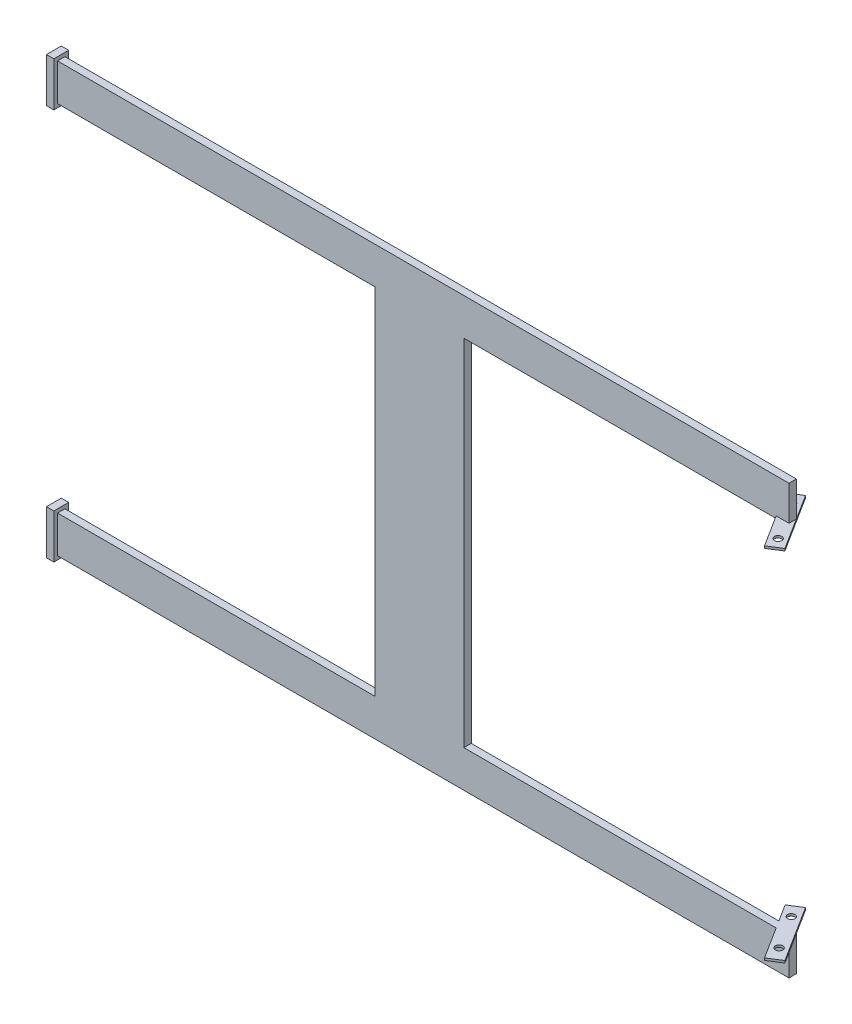
from build123d import *

# Parameters (mm, degrees)
SKETCH1_W           = 1000
SKETCH1_H           = 580
BOSS_EXTRUDE1_DEPTH = 10
SKETCH2_W           = 440
SKETCH2_H           = 480
CUT_EXTRUDE3_DEPTH  = 795.596872652
SHELL2_START        = -593.858216583
SHELL2_OUTLINE_W    = 48
SHELL2_OUTLINE_H    = 8
SHELL2_DEPTH        = 998
SHELL2_START_2      = -153.858216583
SHELL2_2_OUTLINE_W  = 482
SHELL2_2_OUTLINE_H  = 8
SHELL2_2_DEPTH      = 118
BOSS_EXTRUDE2_DEPTH = 3
BOSS_EXTRUDE4_DEPTH = 3
SKETCH11_R          = 5
CUT_EXTRUDE6_DEPTH  = 799.473143596
SKETCH13_R          = 5
CUT_EXTRUDE7_DEPTH  = 799.473143596
SKETCH14_W          = 20
SKETCH14_H          = 60
BOSS_EXTRUDE5_DEPTH = 10
SKETCH15_W          = 20
SKETCH15_H          = 60
BOSS_EXTRUDE6_DEPTH = 10


# Read off the part's stored shape, not the designer's step: Shell2
with BuildPart() as part:
    # Sketch1 → Boss-Extrude1 (new body)
    with BuildSketch(Plane.XY):
        with Locations((-94.858216583, -236.714241493)):
            Rectangle(SKETCH1_W, SKETCH1_H)
    extrude(amount=BOSS_EXTRUDE1_DEPTH)

    # Sketch2 → Cut-Extrude3 (cut, through all)
    with BuildSketch(Plane.XY.offset(10)):
        with Locations((185.141783417, -236.714241493)):
            Rectangle(SKETCH2_W, SKETCH2_H)
        with Locations((-374.858216583, -236.714241493)):
            Rectangle(SKETCH2_W, SKETCH2_H)
    extrude(amount=-CUT_EXTRUDE3_DEPTH, mode=Mode.SUBTRACT)

    # Shell2 outline → Shell2 (cut)
    with BuildSketch(Plane.YZ.offset(SHELL2_START)):
        with Locations((-501.714241493, 5)):
            Rectangle(SHELL2_OUTLINE_W, SHELL2_OUTLINE_H)
        with Locations((28.285758507, 5)):
            Rectangle(SHELL2_OUTLINE_W, SHELL2_OUTLINE_H)
    extrude(amount=SHELL2_DEPTH, mode=Mode.SUBTRACT)

    # Shell2 2 outline → Shell2 2 (cut)
    with BuildSketch(Plane.YZ.offset(SHELL2_START_2)):
        with Locations((-236.714241493, 5)):
            Rectangle(SHELL2_2_OUTLINE_W, SHELL2_2_OUTLINE_H)
    extrude(amount=SHELL2_2_DEPTH, mode=Mode.SUBTRACT)

    # Sketch5 → Boss-Extrude2 (add)
    with BuildSketch(Plane(origin=(0, -476.714241493, 0), x_dir=(1, 0, 0), z_dir=(0, 1, 0))):
        Polygon((405.141783417, 0), (431.885950294, -42.246296146), (414.987431836, -52.943962897), (366.847931456, 23.099370165), (383.746449915, 33.797036917), align=None)
    extrude(amount=-BOSS_EXTRUDE2_DEPTH)

    # Sketch10 → Boss-Extrude4 (add)
    with BuildSketch(Plane.XZ.offset(-3.285758507)):
        Polygon((405.141783417, 0), (431.885972414, 42.246282142), (414.987459557, 52.943957741), (366.847919362, -23.099350115), (383.746432219, -33.797025714), align=None)
    extrude(amount=-BOSS_EXTRUDE4_DEPTH)

    # Sketch11 → Cut-Extrude6 (cut, through all)
    with BuildSketch(Plane.XZ.offset(-3.285758507)):
        with Locations(Location((415.58302294, 35.189085408, 0), (0, 0, 270))):
            Circle(SKETCH11_R)
        with Locations(Location((384.0775579, -14.578315099, 0), (0, 0, 270))):
            Circle(SKETCH11_R)
    extrude(amount=-CUT_EXTRUDE6_DEPTH, mode=Mode.SUBTRACT)

    # Sketch13 → Cut-Extrude7 (cut, through all)
    with BuildSketch(Plane(origin=(0, -476.714241493, 0), x_dir=(1, 0, 0), z_dir=(0, 1, 0))):
        with Locations(Location((413.151340982, -31.347925129, 0), (0, 0, 180))):
            Circle(SKETCH13_R)
        with Locations(Location((384.72142187, 13.561261525, 0), (0, 0, 180))):
            Circle(SKETCH13_R)
    extrude(amount=-CUT_EXTRUDE7_DEPTH, mode=Mode.SUBTRACT)

    # Sketch14 → Boss-Extrude5 (add)
    with BuildSketch(Plane.ZY.offset(594.858216583)):
        with Locations((5, 28.285758507)):
            Rectangle(SKETCH14_W, SKETCH14_H)
    extrude(amount=-BOSS_EXTRUDE5_DEPTH)

    # Sketch15 → Boss-Extrude6 (add)
    with BuildSketch(Plane.ZY.offset(594.858216583)):
        with Locations((5, -501.714241493)):
            Rectangle(SKETCH15_W, SKETCH15_H)
    extrude(amount=-BOSS_EXTRUDE6_DEPTH)


solid = part.part
